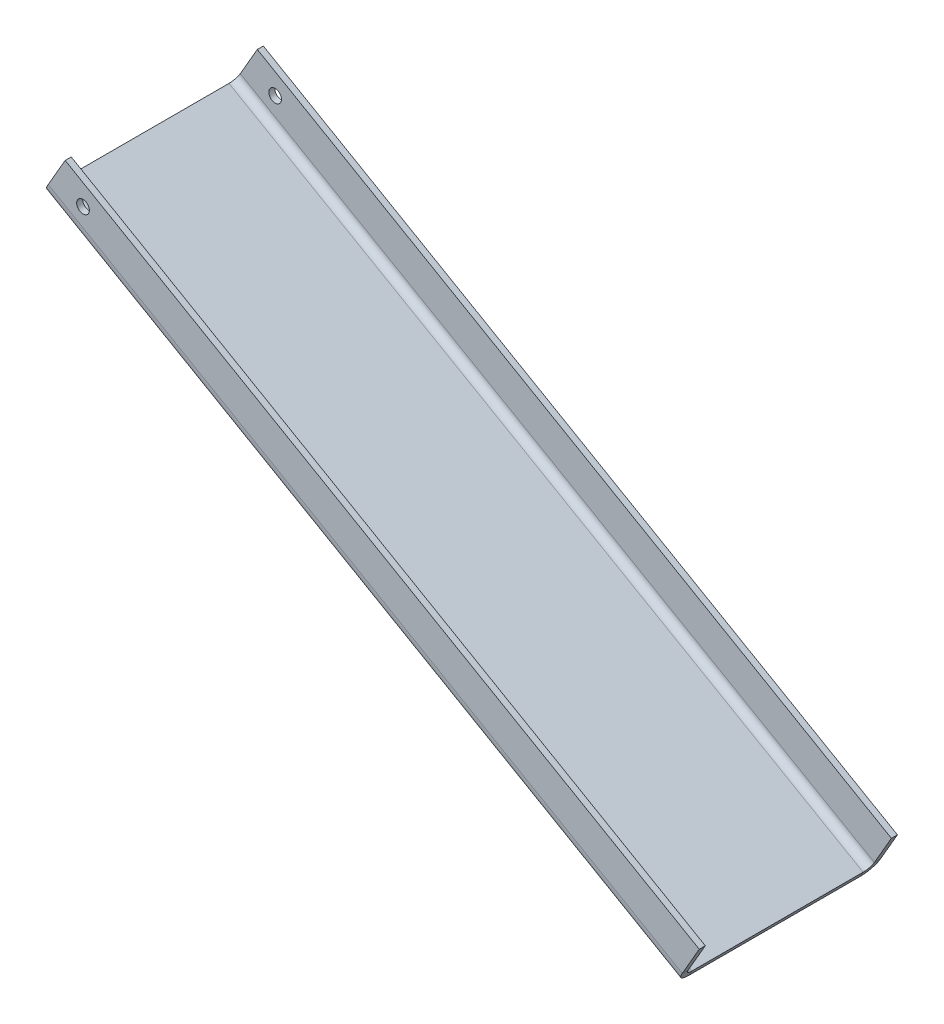
from build123d import *

# Parameters (mm, degrees)
BOSS_EXTRUDE1_DEPTH            = 25
CONVERT_SOLID1_START           = -1.51892
CONVERT_SOLID1_OUTLINE_W       = 184.752086141
CONVERT_SOLID1_OUTLINE_H       = 50
CONVERT_SOLID1_DEPTH           = 0.01892
EDGE_FLANGE1_STRIP_W           = 9.88568
EDGE_FLANGE1_STRIP_H           = 1.51892
EDGE_FLANGE1_STRIP_CUT_DEPTH   = 184.752086141
EDGE_FLANGE1_STRIP_2_W         = 9.88568
EDGE_FLANGE1_STRIP_2_H         = 1.51892
EDGE_FLANGE1_STRIP_CUT_2_DEPTH = 184.752086141
EDGE_FLANGE1_DEPTH             = 184.752086141
EDGE_FLANGE1_BEND_DEPTH        = 184.752086141
CUT_EXTRUDE2_DEPTH             = 197.424354221
CUT_EXTRUDE2_DEPTH_BACK        = 197.424354221
SKETCH13_R                     = 1.6


# Read off the part's stored shape, not the designer's step: Convert-Solid1
# Sheet-metal steps are written as plain solids
with BuildPart() as part:
    # Sketch2 → Boss-Extrude1 (new, symmetric)
    with BuildSketch(Plane.XY):
        Polygon((0, 0), (160, -92.37604307), (159.25, -93.675081176), (-0.75, -1.299038106), align=None)
    extrude(amount=BOSS_EXTRUDE1_DEPTH, both=True)

    # Convert-Solid1 outline → Convert-Solid1 (add)
    with BuildSketch(Plane(origin=(0, 0, 0), x_dir=(0.866025403784438, -0.500000000000001, 0), z_dir=(0.500000000000001, 0.866025403784438, 0)).offset(CONVERT_SOLID1_START)):
        with Locations((92.376043071, 0)):
            Rectangle(CONVERT_SOLID1_OUTLINE_W, CONVERT_SOLID1_OUTLINE_H)
    extrude(amount=CONVERT_SOLID1_DEPTH)

    # Edge-Flange1 strip (across the edge) → Edge-Flange1 strip cut (cut)
    with BuildSketch(Plane(origin=(160, -92.37604307, -25), x_dir=(0, 0, 1), z_dir=(-0.866025403784438, 0.5000000000000011, 0))):
        with Locations((-1.51892, -0.75946)):
            Rectangle(EDGE_FLANGE1_STRIP_W, EDGE_FLANGE1_STRIP_H)
    extrude(amount=EDGE_FLANGE1_STRIP_CUT_DEPTH, mode=Mode.SUBTRACT)

    # Edge-Flange1 strip 2 (across the edge) → Edge-Flange1 strip cut 2 (cut)
    with BuildSketch(Plane(origin=(0, 0, 25), x_dir=(0, 0, -1), z_dir=(0.866025403784438, -0.5000000000000011, 0))):
        with Locations((-1.51892, -0.75946)):
            Rectangle(EDGE_FLANGE1_STRIP_2_W, EDGE_FLANGE1_STRIP_2_H)
    extrude(amount=EDGE_FLANGE1_STRIP_CUT_2_DEPTH, mode=Mode.SUBTRACT)

    # Edge-Flange1 section (across the edge) → Edge-Flange1 (add)
    with BuildSketch(Plane(origin=(160, -92.37604307, -25), x_dir=(0, 0, 1), z_dir=(-0.866025403784438, 0.5000000000000011, 0))):
        with BuildLine():
            Line((0, 1.905), (0, 10.48108))
            Line((0, 10.48108), (1.51892, 10.48108))
            Line((1.51892, 10.48108), (1.51892, 1.905))
            ThreePointArc((1.51892, 1.905), (2.076881582, 0.557961582), (3.42392, 0))
            Line((3.42392, 0), (3.42392, -1.51892))
            ThreePointArc((3.42392, -1.51892), (1.00284295, -0.51607705), (0, 1.905))
        make_face()
    extrude(amount=EDGE_FLANGE1_DEPTH)

    # Edge-Flange1 section 2 (across the edge) → Edge-Flange1 bend (add)
    with BuildSketch(Plane(origin=(0, 0, 25), x_dir=(0, 0, -1), z_dir=(0.866025403784438, -0.5000000000000011, 0))):
        with BuildLine():
            Line((0, 1.905), (0, 10.48108))
            Line((0, 10.48108), (1.51892, 10.48108))
            Line((1.51892, 10.48108), (1.51892, 1.905))
            ThreePointArc((1.51892, 1.905), (2.076881582, 0.557961582), (3.42392, 0))
            Line((3.42392, 0), (3.42392, -1.51892))
            ThreePointArc((3.42392, -1.51892), (1.00284295, -0.51607705), (0, 1.905))
        make_face()
    extrude(amount=EDGE_FLANGE1_BEND_DEPTH)

    # Sketch13 → Cut-Extrude2 (cut, two sides: drawn at the far end of the back side and taken through both)
    with BuildSketch(Plane.XY.offset(25).offset(-CUT_EXTRUDE2_DEPTH_BACK)):
        with Locations(Location((9.743082385, 1.215259675, 0), (0, 0, 90))):
            Circle(SKETCH13_R)
    extrude(amount=CUT_EXTRUDE2_DEPTH + CUT_EXTRUDE2_DEPTH_BACK, mode=Mode.SUBTRACT)


solid = part.part
